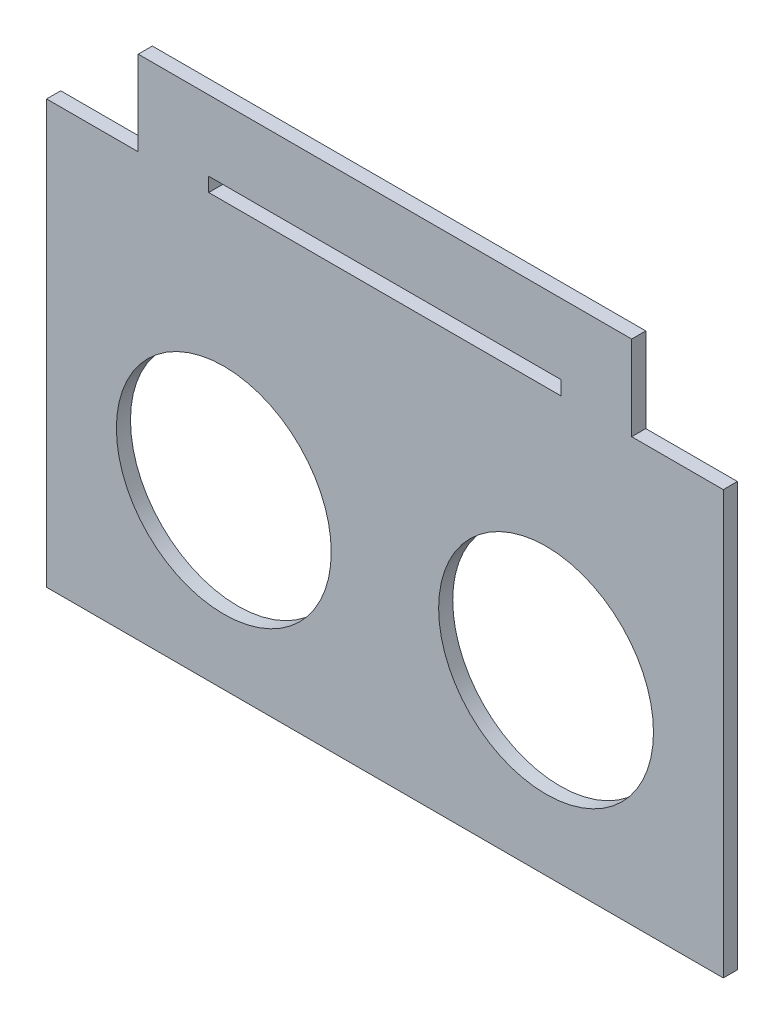
from build123d import *

# Parameters (mm, degrees)
SKICA1_W                = 25
SKICA1_H                = 1
SKICA1_R                = 7.62
P_IDAT_VYSUNUT_M1_DEPTH = 1


with BuildPart() as part:
    # Skica1 → Přidat vysunutím1 (new body)
    with BuildSketch(Plane.XY):
        Polygon((-13.243861265, 5.499663067), (-19.743861265, 5.499663067), (-19.743861265, -24.500336933), (28.256138735, -24.500336933), (28.256138735, 5.499663067), (21.756138735, 5.499663067), (21.756138735, 11.499663067), (-13.243861265, 11.499663067), align=None)
        with Locations((4.256138735, 5.999663067)):
            Rectangle(SKICA1_W, SKICA1_H, mode=Mode.SUBTRACT)
        with Locations((-7.173861265, -12.250168466)):
            Circle(SKICA1_R, mode=Mode.SUBTRACT)
        with Locations((15.683146952, -11.880336933)):
            Circle(SKICA1_R, mode=Mode.SUBTRACT)
    extrude(amount=P_IDAT_VYSUNUT_M1_DEPTH)


solid = part.part
